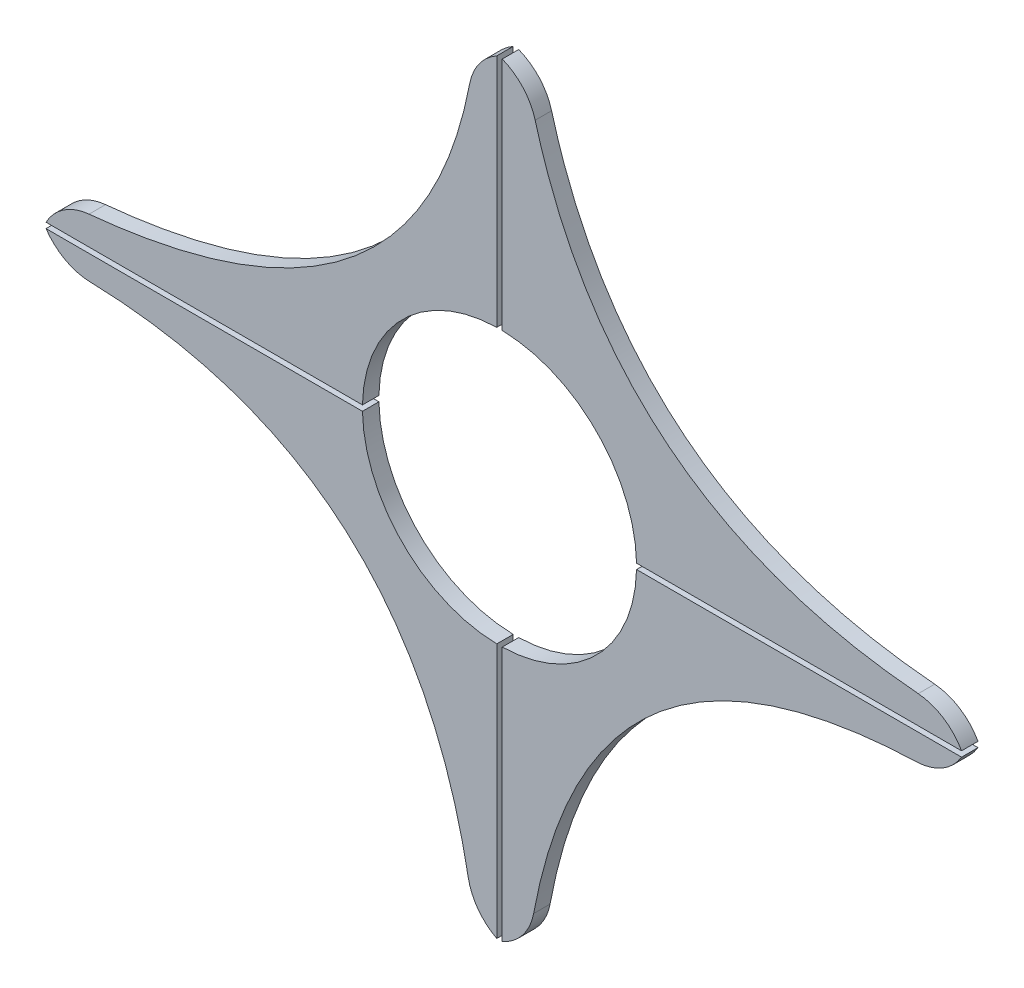
from build123d import *

# Parameters (mm, degrees)
ESBO_O2_W                = 166.979117491
ESBO_O2_H                = 139.409356659
RESSALTO_EXTRUS_O1_DEPTH = 3
ESBO_O3_R                = 25
CORTE_EXTRUS_O1_DEPTH    = 3
CORTE_EXTRUS_O2_DEPTH    = 3
CORTE_EXTRUS_O3_DEPTH    = 3
CORTE_EXTRUS_O4_DEPTH    = 3
CORTE_EXTRUS_O5_DEPTH    = 3
CORTE_EXTRUS_O6_DEPTH    = 3
CORTE_EXTRUS_O7_DEPTH    = 3
CORTE_EXTRUS_O8_DEPTH    = 3
CORTE_EXTRUS_O9_DEPTH    = 3
FILETE1_R                = 10
FILETE2_R                = 10
FILETE3_R                = 10
FILETE4_R                = 10
FILETE5_R                = 10
FILETE6_R                = 10
FILETE7_R                = 10
FILETE8_R                = 10


with BuildPart() as part:
    # Esboço2 → Ressalto-extrusão1 (new body)
    with BuildSketch(Plane.XY):
        with Locations((0.78027625, -1.820644584)):
            Rectangle(ESBO_O2_W, ESBO_O2_H)
    extrude(amount=RESSALTO_EXTRUS_O1_DEPTH)

    # Esboço3 → Corte-extrusão1 (cut)
    with BuildSketch(Plane.XY.offset(3)):
        Circle(ESBO_O3_R)
    extrude(amount=-CORTE_EXTRUS_O1_DEPTH, mode=Mode.SUBTRACT)

    # Esboço4 → Corte-extrusão2 (cut)
    with BuildSketch(Plane.XY.offset(3)):
        Polygon((84.269834995, 0), (84.269834995, 0.5), (24.9949995, 0.5), (25, 0), (24.9949995, -0.5), (84.269834995, -0.5), align=None)
    extrude(amount=-CORTE_EXTRUS_O2_DEPTH, mode=Mode.SUBTRACT)

    # Esboço5 → Corte-extrusão3 (cut)
    with BuildSketch(Plane.XY.offset(3)):
        Polygon((0, 0), (0.5, 0), (0.5, 86.777510053), (-0.5, 86.782496688), (-0.5, 0), align=None)
    extrude(amount=-CORTE_EXTRUS_O3_DEPTH, mode=Mode.SUBTRACT)


with BuildPart() as corte_extrus_o3_piece_1:
    # of the separate pieces the step leaves, piece 1, a body of its own (corte_extrus_o3_pieces)
    add(part.part.solids().sort_by_distance((-82.709282496, 67.884033746, 0))[0])

    # Esboço6 → Corte-extrusão4 (cut)
    with BuildSketch(Plane(origin=(0, 0, 0), x_dir=(-1, 0, 0), z_dir=(0, 0, -1))):
        Polygon((89.244769548, 0), (89.244769548, 0.5), (0, 0.5), (0, 0), (0, -0.5), (89.244769548, -0.5), align=None)
    extrude(amount=-CORTE_EXTRUS_O4_DEPTH, mode=Mode.SUBTRACT)


with BuildPart() as corte_extrus_o3_piece_2:
    # of the separate pieces the step leaves, piece 2, a body of its own (corte_extrus_o3_pieces)
    add(part.part.solids().sort_by_distance((0.5, 67.884033746, 0))[0])

    # Esboço10 → Corte-extrusão8 (cut)
    with BuildSketch(Plane(origin=(0, 0, 0), x_dir=(-1, 0, 0), z_dir=(0, 0, -1))):
        with BuildLine():
            Line((-84.269834995, 5.160229699), (-84.269834995, 67.884033746))
            Line((-84.269834995, 67.884033746), (-4.893293559, 67.884033746))
            add(Edge.make_bspline(
                [(-4.893293559, 67.884033746), (-17.721306454, 6.821872092), (-84.269834995, 5.160229699)],
                knots=[0, 0, 0, 1, 1, 1], degree=2))
        make_face()
    extrude(amount=-CORTE_EXTRUS_O8_DEPTH, mode=Mode.SUBTRACT)

    # Filete1
    # the kernel refuses this fillet: 10 mm, written as the material it takes off along each edge
    with BuildSketch(Plane(origin=(4.893293559, 67.884033746, -17.146220103), x_dir=(-1, 0, 0), z_dir=(0, 0, 1))) as filete1_piece_1:
        with BuildLine():
            CenterArc((8.0342839, 9.313602382), FILETE1_R, 195.346489623, 53.301364135)
            Line((-1.609146052, 6.667046362), (-1.802014651, 6.614115242))
            ThreePointArc((-1.802014651, 6.614115242), (-0.948362714, 3.298866295), (-0.195727502, -0.041118671))
            Line((-0.195727502, -0.041118671), (0, -0.2))
            ThreePointArc((0, -0.2), (2.19664678, -0.2), (4.320473752, -0.186272048))
            Line((4.320473752, -0.186272048), (4.393293559, 0))
        make_face()
    extrude(amount=37.292440207, mode=Mode.SUBTRACT)

    # Filete7
    # the kernel refuses this fillet: 10 mm, written as the material it takes off along each edge
    with BuildSketch(Plane(origin=(84.269834995, 5.160229699, -19.768046081), x_dir=(0, -1, 0), z_dir=(0, 0, 1))) as filete7_piece_1:
        with BuildLine():
            CenterArc((9.543622168, -8.726538718), FILETE7_R, 119.231483424, 56.004156117)
            Line((-0.421824995, -7.895958904), (-0.621133939, -7.879347308))
            ThreePointArc((-0.621133939, -7.879347308), (-0.353220789, -3.940425936), (-0.199937685, 0.004992221))
            Line((-0.199937685, 0.004992221), (0, 0.2))
            ThreePointArc((0, 0.2), (2.33011485, 0.2), (4.56256185, 0.174530774))
            Line((4.56256185, 0.174530774), (4.660229699, 0))
        make_face()
    extrude(amount=42.536092163, mode=Mode.SUBTRACT)


with BuildPart() as corte_extrus_o4_piece_1:
    # of the separate pieces the step leaves, piece 1, a body of its own (corte_extrus_o4_pieces)
    add(corte_extrus_o3_piece_1.part.solids().sort_by_distance((84.269834995, -0.5, 0))[0])

    # Esboço7 → Corte-extrusão5 (cut)
    with BuildSketch(Plane(origin=(0, 0, 0), x_dir=(-1, 0, 0), z_dir=(0, 0, -1))):
        Polygon((0, -80.888519278), (0.5, -80.888519278), (0.5, 0), (0, 0), (-0.5, 0), (-0.5, -80.888519278), align=None)
    extrude(amount=-CORTE_EXTRUS_O5_DEPTH, mode=Mode.SUBTRACT)


with BuildPart() as corte_extrus_o4_piece_2:
    # of the separate pieces the step leaves, piece 2, a body of its own (corte_extrus_o4_pieces)
    add(corte_extrus_o3_piece_1.part.solids().sort_by_distance((-82.709282496, 67.884033746, 0))[0])

    # Esboço8 → Corte-extrusão6 (cut)
    with BuildSketch(Plane(origin=(0, 0, 0), x_dir=(-1, 0, 0), z_dir=(0, 0, -1))):
        with BuildLine():
            Line((4.387941703, 67.884033746), (82.709282496, 67.884033746))
            Line((82.709282496, 67.884033746), (82.709282496, 5.160229699))
            add(Edge.make_bspline(
                [(4.387941703, 67.884033746), (11.301247028, 8.442524073), (82.709282496, 5.160229699)],
                knots=[0, 0, 0, 1, 1, 1], degree=2))
        make_face()
    extrude(amount=-CORTE_EXTRUS_O6_DEPTH, mode=Mode.SUBTRACT)

    # Filete2
    # the kernel refuses this fillet: 10 mm, written as the material it takes off along each edge
    with BuildSketch(Plane(origin=(-4.387941703, 67.884033746, -17.310494796), x_dir=(1, 0, 0), z_dir=(0, 0, 1))) as filete2_piece_1:
        with BuildLine():
            CenterArc((8.776644573, -8.723564882), FILETE2_R, 119.266355834, 49.905014541)
            Line((-1.045290399, -6.844843665), (-1.241729098, -6.807269241))
            ThreePointArc((-1.241729098, -6.807269241), (-0.657736165, -3.401850509), (-0.1986609, 0.023105124))
            Line((-0.1986609, 0.023105124), (0, 0.2))
            ThreePointArc((0, 0.2), (1.943970851, 0.2), (3.790167645, 0.174471298))
            Line((3.790167645, 0.174471298), (3.887941703, 0))
        make_face()
    extrude(amount=37.620989593, mode=Mode.SUBTRACT)

    # Filete3
    # the kernel refuses this fillet: 10 mm, written as the material it takes off along each edge
    with BuildSketch(Plane(origin=(-82.709282496, 5.160229699, -19.684454041), x_dir=(0.9975631232037131, 0.06976972999842818, 0), z_dir=(0, 0, 1))) as filete3_piece_1:
        with BuildLine():
            CenterArc((8.124656882, -9.996852585), FILETE3_R, 91.437560213, 56.232231285)
            Line((-0.325142968, -4.648873294), (-0.494138965, -4.541913708))
            ThreePointArc((-0.494138965, -4.541913708), (-0.362084109, -2.310482701), (-0.199512625, 0.013953946))
            Line((-0.199512625, 0.013953946), (0.004778236, 0.199942913))
            ThreePointArc((0.004778236, 0.199942913), (3.936936221, 0.151815551), (7.868764111, 0.199937052))
            Line((7.868764111, 0.199937052), (7.873781616, 0))
        make_face()
    extrude(amount=42.368908082, mode=Mode.SUBTRACT)


with BuildPart() as corte_extrus_o5_piece_1:
    # of the separate pieces the step leaves, piece 1, a body of its own (corte_extrus_o5_pieces)
    add(corte_extrus_o4_piece_1.part.solids().sort_by_distance((24.9949995, -0.5, 0))[0])

    # Esboço11 → Corte-extrusão9 (cut)
    with BuildSketch(Plane(origin=(0, 0, 0), x_dir=(-1, 0, 0), z_dir=(0, 0, -1))):
        with BuildLine():
            Line((-84.269834995, -71.525322913), (-84.269834995, -5.331601466))
            add(Edge.make_bspline(
                [(-84.269834995, -5.331601466), (-13.611295534, -3.378951706), (-5.095059543, -71.525322913)],
                knots=[0, 0, 0, 1, 1, 1], degree=2))
            Line((-5.095059543, -71.525322913), (-84.269834995, -71.525322913))
        make_face()
    extrude(amount=-CORTE_EXTRUS_O9_DEPTH, mode=Mode.SUBTRACT)

    # Filete6
    # the kernel refuses this fillet: 10 mm, written as the material it takes off along each edge
    with BuildSketch(Plane(origin=(5.095059543, -71.525322913, -18.441831117), x_dir=(-1, 0, 0), z_dir=(0, 0, 1))) as filete6_piece_1:
        with BuildLine():
            CenterArc((8.706016547, -9.115921923), FILETE6_R, 114.273683589, 55.207279263)
            Line((-1.125926489, -7.290299797), (-1.322565349, -7.253787355))
            ThreePointArc((-1.322565349, -7.253787355), (-0.706643901, -3.623013128), (-0.198456314, 0.024801039))
            Line((-0.198456314, 0.024801039), (0, 0.2))
            ThreePointArc((0, 0.2), (2.297529772, 0.2), (4.512840403, 0.182318438))
            Line((4.512840403, 0.182318438), (4.595059543, 0))
        make_face()
    extrude(amount=39.883662235, mode=Mode.SUBTRACT)

    # Filete8
    # the kernel refuses this fillet: 10 mm, written as the material it takes off along each edge
    with BuildSketch(Plane(origin=(84.269834995, -5.331601466, -20.598889075), x_dir=(-0.9999977423526359, -0.002124921088259069, 0), z_dir=(0, 0, 1))) as filete8_piece_1:
        with BuildLine():
            CenterArc((8.55352209, -9.995070038), FILETE8_R, 91.799190978, 57.113212686)
            Line((-0.010266772, -4.831590558), (-0.181542549, -4.728320969))
            ThreePointArc((-0.181542549, -4.728320969), (-0.205132934, -2.415370295), (-0.199999548, 0.000424984))
            Line((-0.199999548, 0.000424984), (0.005949703, 0.199911483))
            ThreePointArc((0.005949703, 0.199911483), (4.119834318, 0.137051672), (8.233276301, 0.199901401))
            Line((8.233276301, 0.199901401), (8.23955563, 0))
        make_face()
    extrude(amount=44.197778151, mode=Mode.SUBTRACT)


with BuildPart() as corte_extrus_o5_piece_2:
    # of the separate pieces the step leaves, piece 2, a body of its own (corte_extrus_o5_pieces)
    add(corte_extrus_o4_piece_1.part.solids().sort_by_distance((-0.5, -71.525322913, 0))[0])

    # Esboço9 → Corte-extrusão7 (cut)
    with BuildSketch(Plane(origin=(0, 0, 0), x_dir=(-1, 0, 0), z_dir=(0, 0, -1))):
        with BuildLine():
            Line((4.589707687, -71.525322913), (82.709282496, -71.525322913))
            Line((82.709282496, -71.525322913), (82.709282496, -4.928069498))
            add(Edge.make_bspline(
                [(82.709282496, -4.928069498), (13.547108577, -2.57847969), (4.589707687, -71.525322913)],
                knots=[0, 0, 0, 1, 1, 1], degree=2))
        make_face()
    extrude(amount=-CORTE_EXTRUS_O7_DEPTH, mode=Mode.SUBTRACT)

    # Filete4
    # the kernel refuses this fillet: 10 mm, written as the material it takes off along each edge
    with BuildSketch(Plane(origin=(-82.709282496, -4.928069498, -20.002365222), x_dir=(0, 1, 0), z_dir=(0, 0, 1))) as filete4_piece_1:
        with BuildLine():
            CenterArc((10.023540315, -8.287985663), FILETE4_R, 124.024481206, 54.330403162)
            Line((0.027662123, -8.00089827), (-0.172255441, -7.995156522))
            ThreePointArc((-0.172255441, -7.995156522), (-0.123523727, -4.000981323), (-0.199884689, -0.006790519))
            Line((-0.199884689, -0.006790519), (0, 0.2))
            ThreePointArc((0, 0.2), (2.214034749, 0.2), (4.316160082, 0.165759713))
            Line((4.316160082, 0.165759713), (4.428069498, 0))
        make_face()
    extrude(amount=43.004730443, mode=Mode.SUBTRACT)

    # Filete5
    # the kernel refuses this fillet: 10 mm, written as the material it takes off along each edge
    with BuildSketch(Plane(origin=(-4.589707687, -71.525322913, -17.798769098), x_dir=(-0.15516216323677826, 0.9878890135534879, 0), z_dir=(0, 0, 1))) as filete5_piece_1:
        with BuildLine():
            CenterArc((7.398291321, -9.996113228), FILETE5_R, 91.597519815, 51.847520572)
            Line((-0.634567892, -4.040177292), (-0.795225076, -3.921058574))
            ThreePointArc((-0.795225076, -3.921058574), (-0.514861749, -1.989056213), (-0.197577803, 0.031032433))
            Line((-0.197577803, 0.031032433), (0.00531892, 0.19992926))
            ThreePointArc((0.00531892, 0.19992926), (3.559802479, 0.151538096), (7.113931966, 0.199922265))
            Line((7.113931966, 0.199922265), (7.119507639, 0))
        make_face()
    extrude(amount=38.597538197, mode=Mode.SUBTRACT)


solid = Compound([corte_extrus_o3_piece_2.part, corte_extrus_o4_piece_2.part, corte_extrus_o5_piece_1.part, corte_extrus_o5_piece_2.part])
